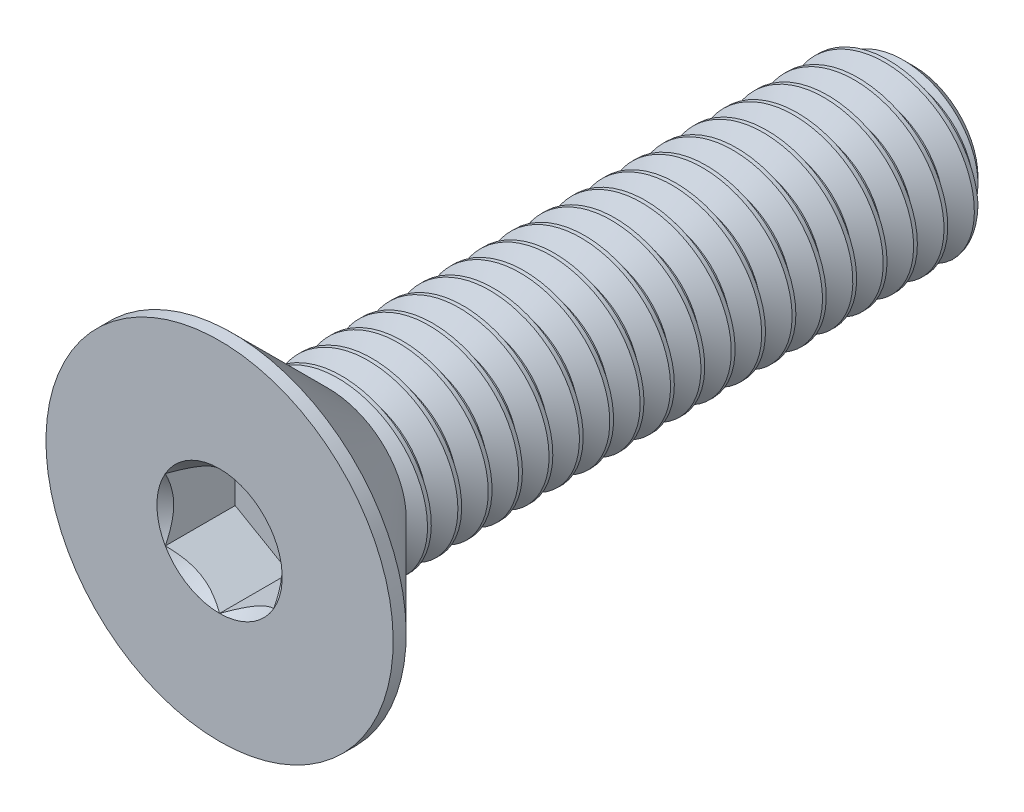
from build123d import *
from build123d.topology import SkipClean

# Parameters (mm, degrees)
SKETCH1_W          = 16
SKETCH1_H          = 2
CHAMFER1_SIZE      = 0.525
CUT_SWEEP1_PITCH   = 0.7
CUT_EXTRUDE2_DEPTH = 1.61


with BuildPart() as part:
    # Sketch1 → Revolve1 (revolve)
    with BuildSketch(Plane(origin=(0, 0, 0), x_dir=(0, 0, -1), z_dir=(1, 0, 0))):
        with Locations((8, 1)):
            Rectangle(SKETCH1_W, SKETCH1_H)
    revolve(axis=Axis((0, 0, -16), (0, 0, 1)))

    # Chamfer1
    chamfer1_edges = [part.edges().sort_by_distance(p)[0] for p in [
        (0, -2, -16),
    ]]
    chamfer(chamfer1_edges, length=CHAMFER1_SIZE)

    # Cut-Sweep1: arcs per turn and ends read off the stored shape
    # Cut-Sweep1: the profile of Sketch2 profile screwed along a right-hand helix through 24 turns, 6 arcs to a turn; built about Z, then put on its axis
    cut_sweep1_z = Axis((0, 0, 0), (0, 0, 1))
    cut_sweep1_corners = [(2.0003, 0, 0.000173205), (2.0003, 0, -0.612673205), (1.545336663, 0, -0.35), (1.545336663, 0, -0.2625)]
    with BuildLine(mode=Mode.PRIVATE) as cut_sweep1_profile:
        Line(cut_sweep1_corners[0], cut_sweep1_corners[1])
        Line(cut_sweep1_corners[1], cut_sweep1_corners[2])
        Line(cut_sweep1_corners[2], cut_sweep1_corners[3])
        Line(cut_sweep1_corners[3], cut_sweep1_corners[0])
    cut_sweep1_cap = Face(cut_sweep1_profile.wire())
    cut_sweep1_turn_angles = [0, 30, 60, 90, 120, 150, 180, 210, 240, 270, 300, 330, 360]
    cut_sweep1_turn_weights = [1, 0.8660254037844387, 1, 0.8660254037844387, 1, 0.8660254037844387, 1, 0.8660254037844387, 1, 0.8660254037844387, 1, 0.8660254037844387, 1]
    cut_sweep1_turn_rails = [Edge.make_bspline([Vector(p[0], p[1], 0).rotate(cut_sweep1_z, cut_sweep1_turn_angles[k]) / cut_sweep1_turn_weights[k] + Vector(0, 0, p[2] + CUT_SWEEP1_PITCH * cut_sweep1_turn_angles[k] / 360) for k in range(13)], [0, 0, 0, 1, 1, 2, 2, 3, 3, 4, 4, 5, 5, 6, 6, 6], 2, cut_sweep1_turn_weights) for p in cut_sweep1_corners]
    cut_sweep1_turn_sides = [Face.make_surface_from_curves(cut_sweep1_turn_rails[p[0]], cut_sweep1_turn_rails[p[1]]) for p in [(0, 1), (1, 2), (2, 3), (3, 0)]]
    cut_sweep1 = Plane(origin=(0, 0, -16), x_dir=(0, 1, 0), z_dir=(0, 0, 1)) * Solid(Shell([*[p.moved(Location((0, 0, CUT_SWEEP1_PITCH * i))) for i in range(24) for p in cut_sweep1_turn_sides], cut_sweep1_cap, cut_sweep1_cap.rotate(cut_sweep1_z, 8640).moved(Location((0, 0, CUT_SWEEP1_PITCH * 8640 / 360)))]))
    add(cut_sweep1, mode=Mode.SUBTRACT)

    # Sketch7 → Revolve2 (revolve)
    with BuildSketch(Plane(origin=(0, 0, 0), x_dir=(0, 0, -1), z_dir=(1, 0, 0)), mode=Mode.PRIVATE) as revolve2_sk:
        Polygon((0, 4), (0.3, 4), (2.3, 2), (2.3, 0), (0, 0), align=None)
    revolve(revolve2_sk.sketch.rotate(Axis((0, 0, 0), (0, 0, -1)), 189.336081704), axis=Axis((0, 0, 0), (0, 0, -1)))

    # Boss-Extrude1 cone 1 section (through the dimple's axis) → Boss-Extrude1 (revolve)
    with SkipClean():  # the faces are left unmerged after this step: merging them gives an invalid solid
        with BuildSketch(Plane(origin=(0, 0, -2.3), x_dir=(0, -1, 0), z_dir=(1, 0, 0))):
            Polygon((0, 0), (2, 0), (0, 2), align=None)
        revolve(axis=Axis((0, 0, -2.3), (0, 0, -1)))

    # Sketch5 → Cut-Extrude2 (cut)
    with SkipClean():  # the faces are left unmerged after this step: merging them gives an invalid solid
        with BuildSketch(Plane.XY):
            Polygon((1.25, -0.721687836), (1.25, 0.721687836), (0, 1.443375673), (-1.25, 0.721687836), (-1.25, -0.721687836), (0, -1.443375673), align=None)
        extrude(amount=-CUT_EXTRUDE2_DEPTH, mode=Mode.SUBTRACT)

    # Cut-Extrude3 cone 1 section (through the dimple's axis) → Cut-Extrude3 (revolve, cut)
    with SkipClean():  # the faces are left unmerged after this step: merging them gives an invalid solid
        with BuildSketch(Plane(origin=(0, 0, 0), x_dir=(0, -1, 0), z_dir=(1, 0, 0))):
            Polygon((0, 0), (1.443375673, 0), (0, 1.443375673), align=None)
        revolve(axis=Axis((0, 0, 0), (0, 0, -1)), mode=Mode.SUBTRACT)


solid = part.part
